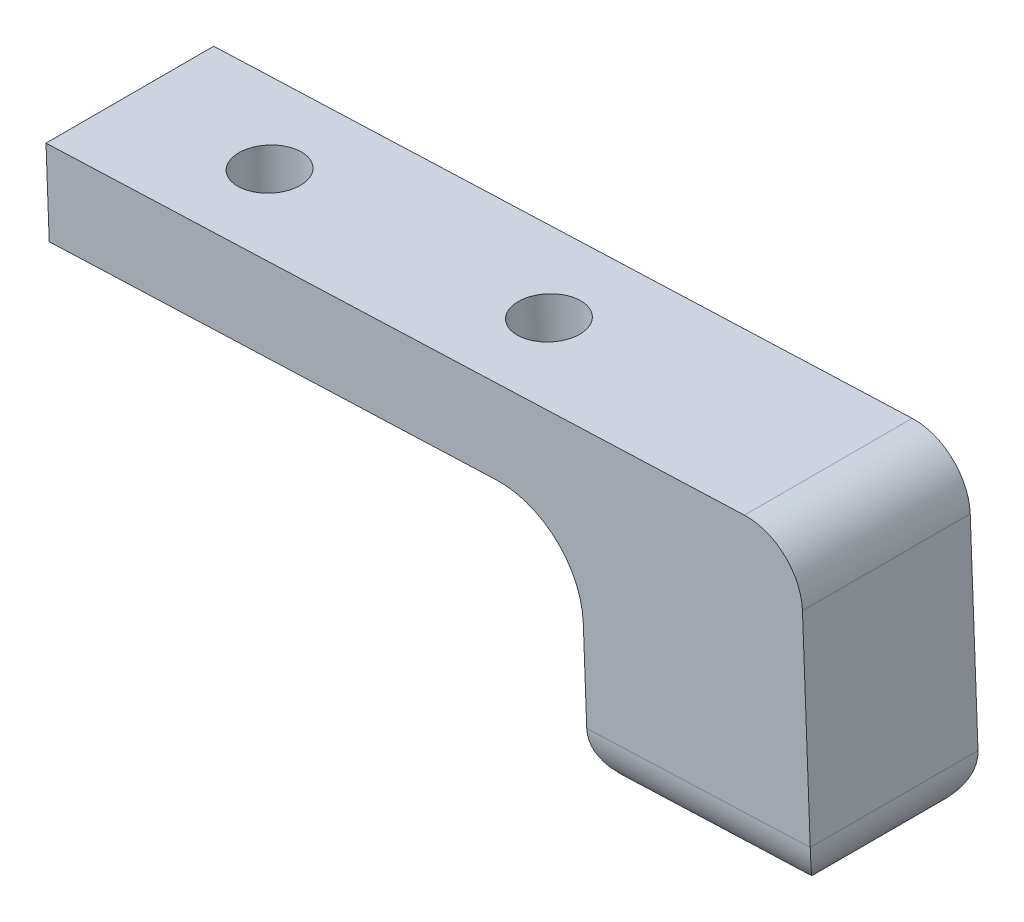
from build123d import *

# Parameters (mm, degrees)
SKETCH1_R           = 1.1
BOSS_EXTRUDE1_DEPTH = 3
SKETCH2_W           = 8
SKETCH2_H           = 6.000000114
BOSS_EXTRUDE2_DEPTH = 8.2
FILLET1_R           = 2
FILLET2_R           = 3
FILLET6_R           = 2
CUT_EXTRUDE1_START  = -1.5
SKETCH3_R           = 2.25
SKETCH3_R_2         = 1.1
CUT_EXTRUDE1_DEPTH  = 1.5


with BuildPart() as part:
    # Sketch1 → Boss-Extrude1 (new body)
    with BuildSketch(Plane(origin=(-0.427235083, 11.053925155, 0), x_dir=(0.9992539214677444, 0.038621243265009195, 0), z_dir=(0.038621243265009195, -0.9992539214677444, 0))):
        Polygon((-27.254588783, 107.999971282), (-18.454588783, 107.999971667), (-7.254588652, 107.999971667), (-7.254588652, 101.999971667), (-18.454588521, 101.999971667), (-27.254588521, 101.999971282), (-34.254588652, 101.999971282), (-34.254588652, 107.999971282), align=None)
        with Locations((-19.254588652, 104.999971632)):
            Circle(SKETCH1_R, mode=Mode.SUBTRACT)
        with Locations((-29.254588652, 104.999971195)):
            Circle(SKETCH1_R, mode=Mode.SUBTRACT)
    extrude(amount=BOSS_EXTRUDE1_DEPTH)

    # Sketch2 → Boss-Extrude2 (add)
    with BuildSketch(Plane(origin=(-0.311371354, 8.056163391, 0), x_dir=(0.9992539214677444, 0.038621243265009306, 0), z_dir=(0.038621243265009306, -0.9992539214677444, 0))):
        with Locations((-11.254588652, 104.99997161)):
            Rectangle(SKETCH2_W, SKETCH2_H)
    extrude(amount=BOSS_EXTRUDE2_DEPTH)

    # Fillet1
    fillet1_edges = [part.edges().sort_by_distance(p)[0] for p in [
        (-11.240869004, -0.572384971, 101.999971553),
        (-15.23788469, -0.726869945, 104.99997161),
        (-11.240869004, -0.572384971, 107.999971667),
        (-7.243853318, -0.417899998, 104.99997161),
    ]]
    fillet(fillet1_edges, radius=FILLET1_R)

    # Fillet2
    fillet2_edges = [part.edges().sort_by_distance(p)[0] for p in [
        (-15.554578885, 7.467012212, 104.99997161),
    ]]
    fillet(fillet2_edges, radius=FILLET2_R)

    # Fillet6
    fillet6_edges = [part.edges().sort_by_distance(p)[0] for p in [
        (-7.676411243, 10.773743922, 104.999971667),
    ]]
    fillet(fillet6_edges, radius=FILLET6_R)

    # Sketch3 → Cut-Extrude1 (cut)
    with BuildSketch(Plane(origin=(-0.311371354, 8.056163391, 0), x_dir=(0.9992539214677444, 0.03862124326500911, 0), z_dir=(0.03862124326500911, -0.9992539214677444, 0)).offset(CUT_EXTRUDE1_START)):
        with Locations((-29.254588652, 104.999971195)):
            Circle(SKETCH3_R)
        with Locations((-29.254588652, 104.999971195)):
            Circle(SKETCH3_R_2, mode=Mode.SUBTRACT)
    extrude(amount=CUT_EXTRUDE1_DEPTH, mode=Mode.SUBTRACT)


solid = part.part
